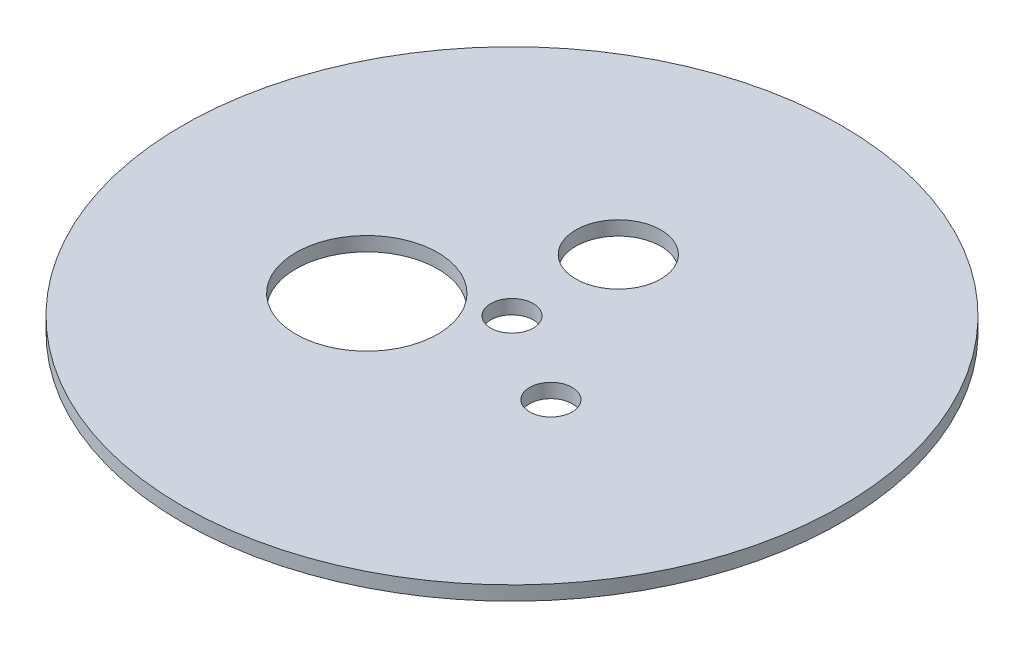
from build123d import *

# Parameters (mm, degrees)
SKETCH1_R           = 46.5
SKETCH1_R_2         = 6
SKETCH1_R_3         = 10
SKETCH1_R_4         = 3
BOSS_EXTRUDE1_DEPTH = 2


with BuildPart() as part:
    # Sketch1 → Boss-Extrude1 (new body)
    with BuildSketch(Plane(origin=(0, 0, 0), x_dir=(1, 0, 0), z_dir=(0, 1, 0))):
        Circle(SKETCH1_R)
        with Locations((0, 15)):
            Circle(SKETCH1_R_2, mode=Mode.SUBTRACT)
        with Locations((-12.990381057, -7.5)):
            Circle(SKETCH1_R_3, mode=Mode.SUBTRACT)
        with Locations((12.990381057, -7.5)):
            Circle(SKETCH1_R_4, mode=Mode.SUBTRACT)
        Circle(SKETCH1_R_4, mode=Mode.SUBTRACT)
    extrude(amount=BOSS_EXTRUDE1_DEPTH)


solid = part.part
